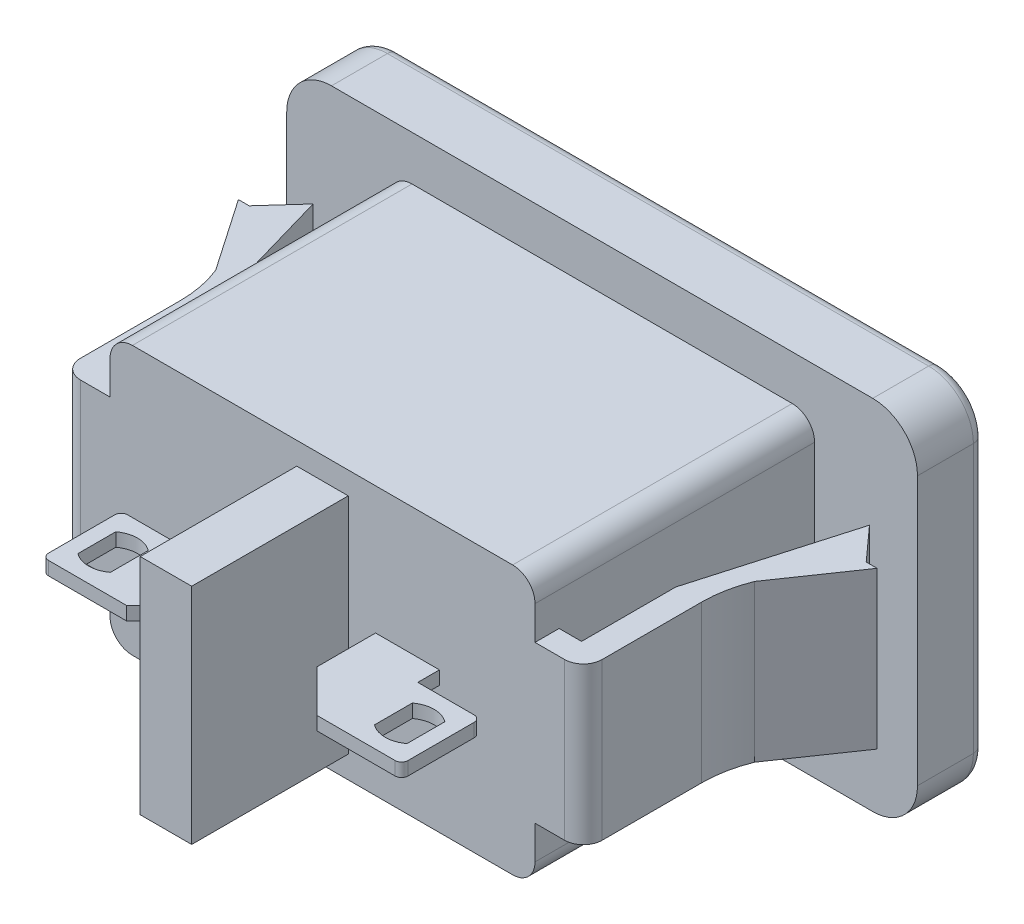
from build123d import *

# Parameters (mm, degrees)
BOSS_EXTRUDE1_DEPTH         = 3
BOSS_EXTRUDE3_DEPTH         = 12.5
BOSS_EXTRUDE7_DEPTH         = 3.5
CUT_EXTRUDE1_DEPTH          = 13.6
SKETCH5_W                   = 2.3
SKETCH5_H                   = 10
BOSS_EXTRUDE4_DEPTH         = 7
SKETCH7_R                   = 3.15
BOSS_EXTRUDE6_DEPTH         = 3.45
SKETCH6_R                   = 1.18
BOSS_EXTRUDE5_DEPTH         = 9.1
FILLET3_R                   = 1.18
FILLET4_R                   = 0.5
BOSS_EXTRUDE8_DEPTH         = 0.3
BOSS_EXTRUDE8_2_DEPTH       = 0.3
BODY_MOVE_COPY1_START       = -0.3
BODY_MOVE_COPY1_DEPTH       = 0.6
BODY_MOVE_COPY1_2_OUTLINE_W = 2.855302951
BODY_MOVE_COPY1_2_OUTLINE_H = 0.131085938
BODY_MOVE_COPY1_2_DEPTH     = 0.6


# Read off the part's stored shape, not the designer's step: Body-Move/Copy1
with BuildPart() as part:
    # Sketch1 → Boss-Extrude1 (new body)
    with BuildSketch(Plane.XY):
        with BuildLine():
            Line((-12.1, -8), (12.1, -8))
            ThreePointArc((12.1, -8), (13.514213562, -7.414213562), (14.1, -6))
            Line((14.1, -6), (14.1, 6))
            ThreePointArc((14.1, 6), (13.514213562, 7.414213562), (12.1, 8))
            Line((12.1, 8), (-12.1, 8))
            ThreePointArc((-12.1, 8), (-13.514213562, 7.414213562), (-14.1, 6))
            Line((-14.1, 6), (-14.1, -6))
            ThreePointArc((-14.1, -6), (-13.514213562, -7.414213562), (-12.1, -8))
        make_face()
    extrude(amount=-BOSS_EXTRUDE1_DEPTH)

    # Sketch3 → Boss-Extrude3 (add)
    with BuildSketch(Plane.XY):
        with BuildLine():
            Line((-8.5, -6), (8.5, -6))
            ThreePointArc((8.5, -6), (9.207106781, -5.707106781), (9.5, -5))
            Line((9.5, -5), (9.5, 5))
            ThreePointArc((9.5, 5), (9.207106781, 5.707106781), (8.5, 6))
            Line((8.5, 6), (-8.5, 6))
            ThreePointArc((-8.5, 6), (-9.207106781, 5.707106781), (-9.5, 5))
            Line((-9.5, 5), (-9.5, -5))
            ThreePointArc((-9.5, -5), (-9.207106781, -5.707106781), (-8.5, -6))
        make_face()
    extrude(amount=BOSS_EXTRUDE3_DEPTH)

    # Sketch10 → Boss-Extrude7 (add, symmetric)
    with BuildSketch(Plane(origin=(0, 0, 0), x_dir=(1, 0, 0), z_dir=(0, 1, 0))):
        with BuildLine():
            Line((12.437506076, -0.483949653), (13.792565104, -1.984193576))
            Line((13.792565104, -1.984193576), (14.276514757, -1.984193576))
            Line((14.276514757, -1.984193576), (12.050346354, -5.22665625))
            ThreePointArc((12.050346354, -5.22665625), (11.760880692, -6.200043614), (11.663186632, -7.210849826))
            Line((11.663186632, -7.210849826), (11.663186632, -11.658617679))
            ThreePointArc((11.663186632, -11.658617679), (11.416751456, -12.253564824), (10.82180431, -12.5))
            Line((10.82180431, -12.5), (9.5, -12.5))
            Line((9.5, -12.5), (9.5, -11.421211806))
            Line((9.5, -11.421211806), (10.501707465, -11.421211806))
            Line((10.501707465, -11.421211806), (10.501707465, -7.210849826))
            Line((10.501707465, -7.210849826), (12.437506076, -0.483949653))
        make_face()
        with BuildLine():
            Line((-9.5, -12.5), (-9.5, -11.421211806))
            Line((-9.5, -11.421211806), (-10.501707465, -11.421211806))
            Line((-10.501707465, -11.421211806), (-10.501707465, -7.210849826))
            Line((-10.501707465, -7.210849826), (-12.437506076, -0.483949653))
            Line((-12.437506076, -0.483949653), (-13.792565104, -1.984193576))
            Line((-13.792565104, -1.984193576), (-14.276514757, -1.984193576))
            Line((-14.276514757, -1.984193576), (-12.050346354, -5.22665625))
            ThreePointArc((-12.050346354, -5.22665625), (-11.760880692, -6.200043614), (-11.663186632, -7.210849826))
            Line((-11.663186632, -7.210849826), (-11.663186632, -11.658617679))
            ThreePointArc((-11.663186632, -11.658617679), (-11.416751456, -12.253564824), (-10.82180431, -12.5))
            Line((-10.82180431, -12.5), (-9.5, -12.5))
        make_face()
    extrude(amount=BOSS_EXTRUDE7_DEPTH, both=True)

    # Sketch4 → Cut-Extrude1 (cut)
    with BuildSketch(Plane.XY.offset(-3)):
        with BuildLine():
            Line((-1.645448267, 3.85), (-0.866025404, 2.5))
            ThreePointArc((-0.866025404, 2.5), (0, 2), (0.866025404, 2.5))
            Line((0.866025404, 2.5), (1.645448267, 3.85))
            ThreePointArc((1.645448267, 3.85), (1.828460969, 4.033012702), (2.078460969, 4.1))
            Line((2.078460969, 4.1), (4.15, 4.1))
            ThreePointArc((4.15, 4.1), (8.25, 0), (4.15, -4.1))
            Line((4.15, -4.1), (2.078460969, -4.1))
            ThreePointArc((2.078460969, -4.1), (1.828460969, -4.033012702), (1.645448267, -3.85))
            Line((1.645448267, -3.85), (0.866025404, -2.5))
            ThreePointArc((0.866025404, -2.5), (0, -2), (-0.866025404, -2.5))
            Line((-0.866025404, -2.5), (-1.645448267, -3.85))
            ThreePointArc((-1.645448267, -3.85), (-1.828460969, -4.033012702), (-2.078460969, -4.1))
            Line((-2.078460969, -4.1), (-4.15, -4.1))
            ThreePointArc((-4.15, -4.1), (-8.25, 0), (-4.15, 4.1))
            Line((-4.15, 4.1), (-2.078460969, 4.1))
            ThreePointArc((-2.078460969, 4.1), (-1.828460969, 4.033012702), (-1.645448267, 3.85))
        make_face()
    extrude(amount=CUT_EXTRUDE1_DEPTH, mode=Mode.SUBTRACT)

    # Sketch5 → Boss-Extrude4 (add)
    with BuildSketch(Plane.XY.offset(12.5)):
        Rectangle(SKETCH5_W, SKETCH5_H)
    extrude(amount=BOSS_EXTRUDE4_DEPTH)

    # Sketch7 → Boss-Extrude6 (add)
    with BuildSketch(Plane(origin=(0, 0, 10.6), x_dir=(-1, 0, 0), z_dir=(0, 0, -1))):
        with Locations(Location((-4.3, 0, 0), (0, 0, 180))):
            Circle(SKETCH7_R)
        with Locations(Location((4.3, 0, 0), (0, 0, 180))):
            Circle(SKETCH7_R)
    extrude(amount=BOSS_EXTRUDE6_DEPTH)

    # Sketch6 → Boss-Extrude5 (add)
    with BuildSketch(Plane(origin=(0, 0, 7.15), x_dir=(-1, 0, 0), z_dir=(0, 0, -1))):
        with Locations((-4.3, 0)):
            Circle(SKETCH6_R)
        with Locations((4.3, 0)):
            Circle(SKETCH6_R)
    extrude(amount=BOSS_EXTRUDE5_DEPTH)

    # Fillet3
    fillet3_edges = [part.edges().sort_by_distance(p)[0] for p in [
        (5.48, 0, -1.95),
        (-3.12, 0, -1.95),
    ]]
    fillet(fillet3_edges, radius=FILLET3_R)

    # Fillet4
    fillet4_edges = [part.edges().sort_by_distance(p)[0] for p in [
        (-13.514213562, 7.414213562, -3),
        (-14.1, 0, -3),
        (-13.514213562, -7.414213562, -3),
        (0, -8, -3),
        (13.514213562, -7.414213562, -3),
        (14.1, 0, -3),
        (13.514213562, 7.414213562, -3),
        (0, 8, -3),
    ]]
    fillet(fillet4_edges, radius=FILLET4_R)


with BuildPart() as body_2:
    # Sketch11 → Boss-Extrude8 (new, symmetric)
    with BuildSketch(Plane(origin=(0, 0, 0), x_dir=(1, 0, 0), z_dir=(0, 1, 0))):
        with BuildLine():
            Line((2.371353299, -12.631085938), (2.371353299, -15.244414062))
            Line((2.371353299, -15.244414062), (4.258756944, -17.131817708))
            Line((4.258756944, -17.131817708), (7.743194444, -17.131817708))
            ThreePointArc((7.743194444, -17.131817708), (7.948516893, -17.046770365), (8.033564236, -16.841447917))
            Line((8.033564236, -16.841447917), (8.033564236, -13.889355035))
            ThreePointArc((8.033564236, -13.889355035), (7.948516893, -13.684032586), (7.743194444, -13.598985243))
            Line((7.743194444, -13.598985243), (5.22665625, -13.598985243))
            Line((5.22665625, -13.598985243), (5.22665625, -12.631085938))
            Line((5.22665625, -12.631085938), (2.371353299, -12.631085938))
        make_face()
        with BuildLine():
            Line((5.904185764, -14.518489583), (5.904185764, -16.212313368))
            ThreePointArc((5.904185764, -16.212313368), (6.630110243, -16.454288194), (7.356034722, -16.212313368))
            Line((7.356034722, -16.212313368), (7.356034722, -14.518489583))
            ThreePointArc((7.356034722, -14.518489583), (6.630110243, -14.276514757), (5.904185764, -14.518489583))
        make_face(mode=Mode.SUBTRACT)
    extrude(amount=BOSS_EXTRUDE8_DEPTH, both=True)


with BuildPart() as body_3:
    # Sketch11 → Boss-Extrude8 2 (new, symmetric)
    with BuildSketch(Plane(origin=(0, 0, 0), x_dir=(1, 0, 0), z_dir=(0, 1, 0))):
        with BuildLine():
            Line((-2.371353299, -12.631085938), (-5.22665625, -12.631085938))
            Line((-5.22665625, -12.631085938), (-5.22665625, -13.598985243))
            Line((-5.22665625, -13.598985243), (-7.743194444, -13.598985243))
            ThreePointArc((-7.743194444, -13.598985243), (-7.948516893, -13.684032586), (-8.033564236, -13.889355035))
            Line((-8.033564236, -13.889355035), (-8.033564236, -16.841447917))
            ThreePointArc((-8.033564236, -16.841447917), (-7.948516893, -17.046770365), (-7.743194444, -17.131817708))
            Line((-7.743194444, -17.131817708), (-4.258756944, -17.131817708))
            Line((-4.258756944, -17.131817708), (-2.371353299, -15.244414062))
            Line((-2.371353299, -15.244414062), (-2.371353299, -12.631085938))
        make_face()
        with BuildLine():
            Line((-7.356034722, -14.518489583), (-7.356034722, -16.212313368))
            ThreePointArc((-7.356034722, -16.212313368), (-6.630110243, -16.454288194), (-5.904185764, -16.212313368))
            Line((-5.904185764, -16.212313368), (-5.904185764, -14.518489583))
            ThreePointArc((-5.904185764, -14.518489583), (-6.630110243, -14.276514757), (-7.356034722, -14.518489583))
        make_face(mode=Mode.SUBTRACT)
    extrude(amount=BOSS_EXTRUDE8_2_DEPTH, both=True)


with BuildPart() as body_move_copy1_tool:
    # Body-Move/Copy1 outline → Body-Move/Copy1 (new body)
    with BuildSketch(Plane(origin=(0, 0, 0), x_dir=(1, 0, 0), z_dir=(0, 1, 0)).offset(BODY_MOVE_COPY1_START)):
        with BuildLine():
            Line((-4.258756944, -17.000731771), (-7.743194444, -17.000731771))
            ThreePointArc((-7.743194444, -17.000731771), (-7.948516893, -16.915684428), (-8.033564236, -16.710361979))
            Line((-8.033564236, -16.710361979), (-8.033564236, -16.841447917))
            ThreePointArc((-8.033564236, -16.841447917), (-7.948516893, -17.046770365), (-7.743194444, -17.131817708))
            Line((-7.743194444, -17.131817708), (-4.258756944, -17.131817708))
            Line((-4.258756944, -17.131817708), (-2.371353299, -15.244414063))
            Line((-2.371353299, -15.244414063), (-2.371353299, -15.113328125))
            Line((-2.371353299, -15.113328125), (-4.258756944, -17.000731771))
        make_face()
        with BuildLine():
            ThreePointArc((8.033564236, -16.710361979), (7.948516893, -16.915684428), (7.743194444, -17.000731771))
            Line((7.743194444, -17.000731771), (4.258756944, -17.000731771))
            Line((4.258756944, -17.000731771), (2.371353299, -15.113328125))
            Line((2.371353299, -15.113328125), (2.371353299, -15.244414063))
            Line((2.371353299, -15.244414063), (4.258756944, -17.131817708))
            Line((4.258756944, -17.131817708), (7.743194444, -17.131817708))
            ThreePointArc((7.743194444, -17.131817708), (7.948516893, -17.046770365), (8.033564236, -16.841447917))
            Line((8.033564236, -16.841447917), (8.033564236, -16.710361979))
        make_face()
        with BuildLine():
            ThreePointArc((-7.356034722, -14.518489583), (-6.630110243, -14.276514757), (-5.904185764, -14.518489583))
            Line((-5.904185764, -14.518489583), (-5.904185764, -14.387403646))
            ThreePointArc((-5.904185764, -14.387403646), (-6.630110243, -14.145428819), (-7.356034722, -14.387403646))
            Line((-7.356034722, -14.387403646), (-7.356034722, -14.518489583))
        make_face()
        with BuildLine():
            ThreePointArc((5.904185764, -14.518489583), (6.630110243, -14.276514757), (7.356034722, -14.518489583))
            Line((7.356034722, -14.518489583), (7.356034722, -14.387403646))
            ThreePointArc((7.356034722, -14.387403646), (6.630110243, -14.145428819), (5.904185764, -14.387403646))
            Line((5.904185764, -14.387403646), (5.904185764, -14.518489583))
        make_face()
    extrude(amount=BODY_MOVE_COPY1_DEPTH)


with BuildPart() as body_2_1:
    add(body_2.part)

    # Body-Move/Copy1: cut by body_move_copy1_tool
    add(body_move_copy1_tool.part, mode=Mode.SUBTRACT)


with BuildPart() as body_3_1:
    add(body_3.part)

    # Body-Move/Copy1: cut by body_move_copy1_tool
    add(body_move_copy1_tool.part, mode=Mode.SUBTRACT)


    add(body_2_1.part)  # Body-Move_Copy1 2 merges body 2
    # Body-Move_Copy1 2 outline → Body-Move_Copy1 2 (add)
    with BuildSketch(Plane(origin=(0, 0, 0), x_dir=(1, 0, 0), z_dir=(0, 1, 0)).offset(BODY_MOVE_COPY1_START)):
        with BuildLine():
            Line((-8.033564236, -13.758269097), (-8.033564236, -13.889355035))
            ThreePointArc((-8.033564236, -13.889355035), (-7.948516893, -13.684032586), (-7.743194444, -13.598985243))
            Line((-7.743194444, -13.598985243), (-5.22665625, -13.598985243))
            Line((-5.22665625, -13.598985243), (-5.22665625, -13.467899306))
            Line((-5.22665625, -13.467899306), (-7.743194444, -13.467899306))
            ThreePointArc((-7.743194444, -13.467899306), (-7.948516893, -13.552946648), (-8.033564236, -13.758269097))
        make_face()
        with Locations((-3.799004775, -12.565542969)):
            Rectangle(BODY_MOVE_COPY1_2_OUTLINE_W, BODY_MOVE_COPY1_2_OUTLINE_H)
        with BuildLine():
            ThreePointArc((7.743194444, -13.598985243), (7.948516893, -13.684032586), (8.033564236, -13.889355035))
            Line((8.033564236, -13.889355035), (8.033564236, -13.758269097))
            ThreePointArc((8.033564236, -13.758269097), (7.948516893, -13.552946648), (7.743194444, -13.467899306))
            Line((7.743194444, -13.467899306), (5.22665625, -13.467899306))
            Line((5.22665625, -13.467899306), (5.22665625, -13.598985243))
            Line((5.22665625, -13.598985243), (7.743194444, -13.598985243))
        make_face()
        with Locations((3.799004775, -12.565542969)):
            Rectangle(BODY_MOVE_COPY1_2_OUTLINE_W, BODY_MOVE_COPY1_2_OUTLINE_H)
        with BuildLine():
            Line((-5.904185764, -16.212313368), (-5.904185764, -16.081227431))
            ThreePointArc((-5.904185764, -16.081227431), (-6.630110243, -16.323202257), (-7.356034722, -16.081227431))
            Line((-7.356034722, -16.081227431), (-7.356034722, -16.212313368))
            ThreePointArc((-7.356034722, -16.212313368), (-6.630110243, -16.454288194), (-5.904185764, -16.212313368))
        make_face()
        with BuildLine():
            Line((7.356034722, -16.212313368), (7.356034722, -16.081227431))
            ThreePointArc((7.356034722, -16.081227431), (6.630110243, -16.323202257), (5.904185764, -16.081227431))
            Line((5.904185764, -16.081227431), (5.904185764, -16.212313368))
            ThreePointArc((5.904185764, -16.212313368), (6.630110243, -16.454288194), (7.356034722, -16.212313368))
        make_face()
    extrude(amount=BODY_MOVE_COPY1_2_DEPTH)


solid = Compound([part.part, body_3_1.part])
